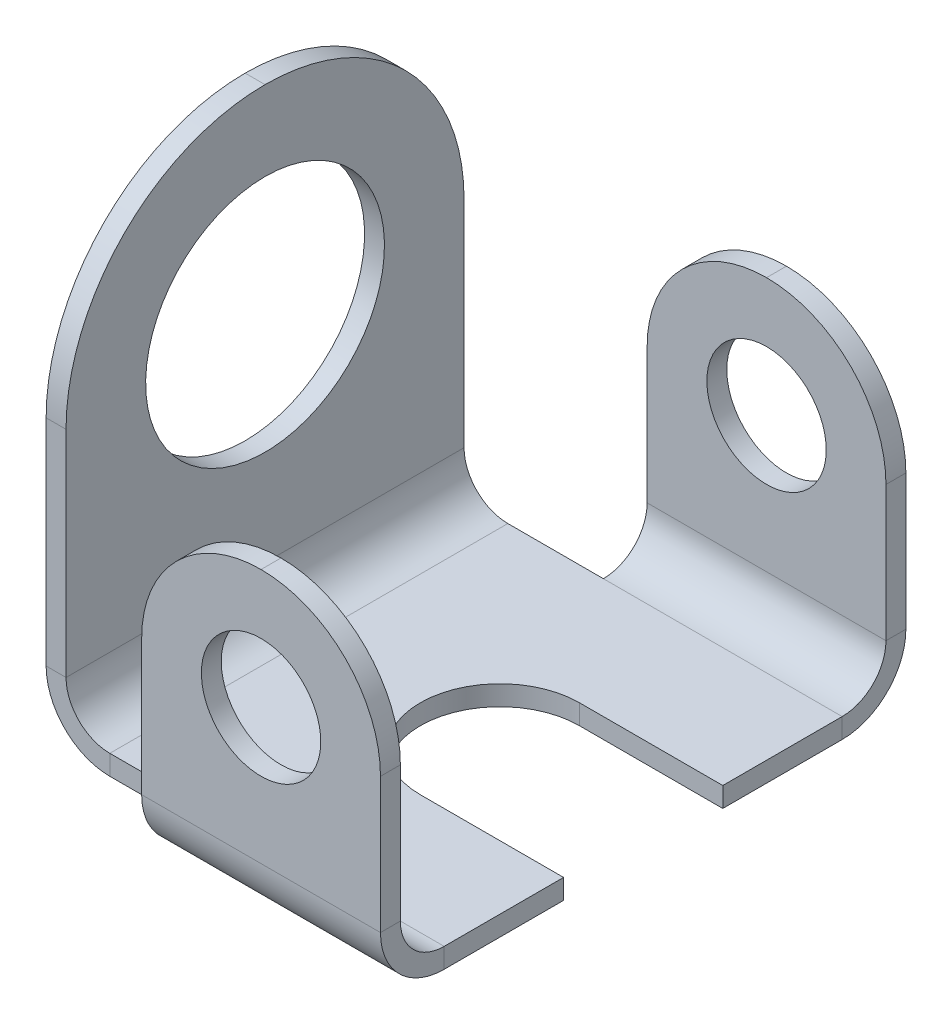
from build123d import *

# Parameters (mm, degrees)
SKETCH1_W                    = 50
SKETCH1_H                    = 50
BASE_FLANGE1_DEPTH           = 2.5
EDGE_FLANGE1_STRIP_W         = 21
EDGE_FLANGE1_STRIP_H         = 2.5
EDGE_FLANGE1_STRIP_CUT_DEPTH = 50
EDGE_FLANGE1_DEPTH           = 50
BREAK_CORNER1_START          = -25
BREAK_CORNER1_DEPTH          = 2.5
SKETCH9_R                    = 15
CUT_EXTRUDE1_DEPTH           = 10
EDGE_FLANGE2_DEPTH           = 30
BREAK_CORNER2_START          = -33
BREAK_CORNER2_DEPTH          = 66
CUT_EXTRUDE2_DEPTH           = 93.633687177
CUT_EXTRUDE2_DEPTH_BACK      = 93.633687177
SKETCH13_R                   = 7.5
CUT_EXTRUDE3_DEPTH           = 71.853722556
CUT_EXTRUDE3_DEPTH_BACK      = 71.853722556


# Read off the part's stored shape, not the designer's step: Break-Corner1, Break-Corner2
# Sheet-metal steps are written as plain solids
with BuildPart() as part:
    # Sketch1 → Base-Flange1 (new body)
    with BuildSketch(Plane(origin=(0, 0, 0), x_dir=(1, 0, 0), z_dir=(0, 1, 0))):
        Rectangle(SKETCH1_W, SKETCH1_H)
    extrude(amount=BASE_FLANGE1_DEPTH)

    # Edge-Flange1 strip (across the edge) → Edge-Flange1 strip cut (cut)
    with BuildSketch(Plane(origin=(-25, 2.5, -25), x_dir=(1, 0, 0), z_dir=(0, 0, 1))):
        with Locations((-2.5, -1.25)):
            Rectangle(EDGE_FLANGE1_STRIP_W, EDGE_FLANGE1_STRIP_H)
    extrude(amount=EDGE_FLANGE1_STRIP_CUT_DEPTH, mode=Mode.SUBTRACT)

    # Edge-Flange1 section (across the edge) → Edge-Flange1 (add)
    with BuildSketch(Plane(origin=(-25, 2.5, -25), x_dir=(1, 0, 0), z_dir=(0, 0, 1))):
        with BuildLine():
            Line((0, 5.5), (0, 57.5))
            Line((0, 57.5), (2.5, 57.5))
            Line((2.5, 57.5), (2.5, 5.5))
            ThreePointArc((2.5, 5.5), (4.110912703, 1.610912703), (8, 0))
            Line((8, 0), (8, -2.5))
            ThreePointArc((8, -2.5), (2.343145751, -0.156854249), (0, 5.5))
        make_face()
    extrude(amount=EDGE_FLANGE1_DEPTH)

    # Break-Corner1 outline → Break-Corner1 (cut)
    with BuildSketch(Plane.YZ.offset(BREAK_CORNER1_START)):
        with BuildLine():
            Line((60, -25), (60, 0))
            ThreePointArc((60, 0), (52.67766953, -17.67766953), (35, -25))
            Line((35, -25), (60, -25))
        make_face()
        with BuildLine():
            ThreePointArc((35, 25), (52.67766953, 17.67766953), (60, 0))
            Line((60, 0), (60, 25))
            Line((60, 25), (35, 25))
        make_face()
    extrude(amount=BREAK_CORNER1_DEPTH, mode=Mode.SUBTRACT)

    # Sketch9 → Cut-Extrude1 (cut)
    with BuildSketch(Plane(origin=(-22.5, 0, 0), x_dir=(0, 0, -1), z_dir=(1, 0, 0))):
        with Locations(Location((0, 35, 0), (0, 0, 90))):
            Circle(SKETCH9_R)
    extrude(amount=-CUT_EXTRUDE1_DEPTH, mode=Mode.SUBTRACT)

    # Edge-Flange2 section (across the edge) → Edge-Flange2 (add)
    with BuildSketch(Plane(origin=(-5, 2.5, 30.5), x_dir=(0, 0, -1), z_dir=(1, 0, 0))):
        with BuildLine():
            Line((-2.5, 5.5), (-2.5, 37.5))
            Line((-2.5, 37.5), (0, 37.5))
            Line((0, 37.5), (0, 5.5))
            ThreePointArc((0, 5.5), (1.610912703, 1.610912703), (5.5, 0))
            Line((5.5, 0), (5.5, -2.5))
            ThreePointArc((5.5, -2.5), (-0.156854249, -0.156854249), (-2.5, 5.5))
        make_face()
    edge_flange2 = extrude(amount=EDGE_FLANGE2_DEPTH)

    # Mirror1: Edge-Flange2 across plane
    add(edge_flange2.mirror(Plane.XY))

    # Break-Corner2 outline → Break-Corner2 (cut)
    with BuildSketch(Plane.XY.offset(BREAK_CORNER2_START)):
        with BuildLine():
            ThreePointArc((-5, 25), (-0.606601718, 35.606601718), (10, 40))
            Line((10, 40), (-5, 40))
            Line((-5, 40), (-5, 25))
        make_face()
        with BuildLine():
            ThreePointArc((10, 40), (20.606601718, 35.606601718), (25, 25))
            Line((25, 25), (25, 40))
            Line((25, 40), (10, 40))
        make_face()
    extrude(amount=BREAK_CORNER2_DEPTH, mode=Mode.SUBTRACT)

    # Sketch13 → Cut-Extrude2 (cut, two sides: drawn at the far end of the back side and taken through both)
    with BuildSketch(Plane(origin=(0, 0, -33), x_dir=(-1, 0, 0), z_dir=(0, 0, -1)).offset(-CUT_EXTRUDE2_DEPTH_BACK)):
        with Locations(Location((-10, 25, 0), (0, 0, 90))):
            Circle(SKETCH13_R)
    extrude(amount=CUT_EXTRUDE2_DEPTH + CUT_EXTRUDE2_DEPTH_BACK, mode=Mode.SUBTRACT)

    # Sketch14 → Cut-Extrude3 (cut, two sides: drawn at the far end of the back side and taken through both)
    with BuildSketch(Plane(origin=(0, 2.5, 0), x_dir=(1, 0, 0), z_dir=(0, 1, 0)).offset(-CUT_EXTRUDE3_DEPTH_BACK)):
        with BuildLine():
            Line((7, 10), (37.302325581, 10))
            ThreePointArc((37.302325581, 10), (47.302325581, 0), (37.302325581, -10))
            Line((37.302325581, -10), (7, -10))
            ThreePointArc((7, -10), (-3, 0), (7, 10))
        make_face()
    extrude(amount=CUT_EXTRUDE3_DEPTH + CUT_EXTRUDE3_DEPTH_BACK, mode=Mode.SUBTRACT)


solid = part.part
